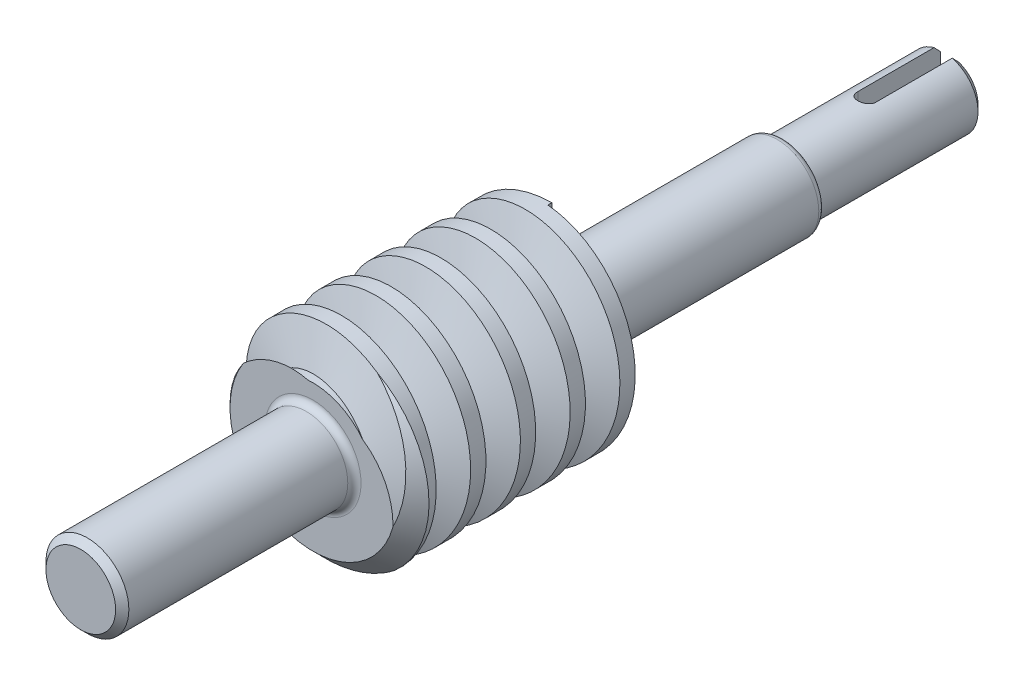
from build123d import *

# Parameters (mm, degrees)
SKETCH1_R                = 30
BOSS_EXTRUDE1_DEPTH      = 36
CHAMFER1_SIZE            = 5
CUT_SWEEP1_PITCH         = 15
BOSS_EXTRUDE2_DEPTH      = 70
BOSS_EXTRUDE2_DEPTH_BACK = 142
SKETCH4_R                = 12.5
SKETCH5_R                = 10.5
BOSS_EXTRUDE3_DEPTH      = 50
FILLET1_R                = 2
CHAMFER2_SIZE            = 2
CUT_EXTRUDE1_DEPTH       = 50


with BuildPart() as part:
    # Sketch1 → Boss-Extrude1 (new, symmetric)
    with BuildSketch(Plane.XY):
        Circle(SKETCH1_R)
    extrude(amount=BOSS_EXTRUDE1_DEPTH, both=True)

    # Chamfer1
    chamfer1_edges = [part.edges().sort_by_distance(p)[0] for p in [
        (-30, 0, 36),
    ]]
    chamfer(chamfer1_edges, length=CHAMFER1_SIZE)

    # Cut-Sweep1: the profile of Sketch2 screwed along a left-hand helix of 6 turns, 18 arcs to a turn; built about Z, then put on its axis
    cut_sweep1_z = Axis((0, 0, 0), (0, 0, 1))
    cut_sweep1_corners = [(34, 0, -7.84), (34, 0, 5.459553514), (19, 0, 0), (19, 0, -2.380446486)]
    with BuildLine(mode=Mode.PRIVATE) as cut_sweep1_profile:
        Line(cut_sweep1_corners[0], cut_sweep1_corners[1])
        Line(cut_sweep1_corners[1], cut_sweep1_corners[2])
        Line(cut_sweep1_corners[2], cut_sweep1_corners[3])
        Line(cut_sweep1_corners[3], cut_sweep1_corners[0])
    cut_sweep1_cap = Face(cut_sweep1_profile.wire())
    cut_sweep1_turn_angles = [0, -10, -20, -30, -40, -50, -60, -70, -80, -90, -100, -110, -120, -130, -140, -150, -160, -170, -180, -190, -200, -210, -220, -230, -240, -250, -260, -270, -280, -290, -300, -310, -320, -330, -340, -350, -360]
    cut_sweep1_turn_weights = [1, 0.984807753012208, 1, 0.984807753012208, 1, 0.984807753012208, 1, 0.984807753012208, 1, 0.984807753012208, 1, 0.984807753012208, 1, 0.984807753012208, 1, 0.984807753012208, 1, 0.984807753012208, 1, 0.984807753012208, 1, 0.984807753012208, 1, 0.984807753012208, 1, 0.984807753012208, 1, 0.984807753012208, 1, 0.984807753012208, 1, 0.984807753012208, 1, 0.984807753012208, 1, 0.984807753012208, 1]
    cut_sweep1_turn_rails = [Edge.make_bspline([Vector(p[0], p[1], 0).rotate(cut_sweep1_z, cut_sweep1_turn_angles[k]) / cut_sweep1_turn_weights[k] + Vector(0, 0, p[2] + -CUT_SWEEP1_PITCH * cut_sweep1_turn_angles[k] / 360) for k in range(37)], [0, 0, 0, 1, 1, 2, 2, 3, 3, 4, 4, 5, 5, 6, 6, 7, 7, 8, 8, 9, 9, 10, 10, 11, 11, 12, 12, 13, 13, 14, 14, 15, 15, 16, 16, 17, 17, 18, 18, 18], 2, cut_sweep1_turn_weights) for p in cut_sweep1_corners]
    cut_sweep1_turn_sides = [Face.make_surface_from_curves(cut_sweep1_turn_rails[p[0]], cut_sweep1_turn_rails[p[1]]) for p in [(0, 1), (1, 2), (2, 3), (3, 0)]]
    cut_sweep1 = Plane(origin=(0, 0, 48.809776757), x_dir=(0, 1, 0), z_dir=(0, 0, -1)) * Solid(Shell([*[p.moved(Location((0, 0, CUT_SWEEP1_PITCH * i))) for i in range(6) for p in cut_sweep1_turn_sides], cut_sweep1_cap, cut_sweep1_cap.rotate(cut_sweep1_z, -2160).moved(Location((0, 0, -CUT_SWEEP1_PITCH * -2160 / 360)))]))
    add(cut_sweep1, mode=Mode.SUBTRACT)

    # Sketch4 → Boss-Extrude2 (add, two sides: drawn at the far end of the back side and taken through both)
    with BuildSketch(Plane.XY.offset(36).offset(-BOSS_EXTRUDE2_DEPTH_BACK)):
        Circle(SKETCH4_R)
    extrude(amount=BOSS_EXTRUDE2_DEPTH + BOSS_EXTRUDE2_DEPTH_BACK)

    # Sketch5 → Boss-Extrude3 (add)
    with BuildSketch(Plane(origin=(0, 0, -106), x_dir=(-1, 0, 0), z_dir=(0, 0, -1))):
        Circle(SKETCH5_R)
    extrude(amount=BOSS_EXTRUDE3_DEPTH)

    # Fillet1
    fillet1_edges = [part.edges().sort_by_distance(p)[0] for p in [
        (-12.5, 0, 36),
        (-12.5, 0, -36),
        (-12.5, 0, -106),
    ]]
    fillet(fillet1_edges, radius=FILLET1_R - 0.0001)  # a hair under: the kernel refuses the full size

    # Chamfer2
    chamfer2_edges = [part.edges().sort_by_distance(p)[0] for p in [
        (-12.5, 0, 106),
        (10.5, 0, -156),
    ]]
    chamfer(chamfer2_edges, length=CHAMFER2_SIZE)

    # Sketch6 → Cut-Extrude1 (cut)
    with BuildSketch(Plane(origin=(0, 0, 0), x_dir=(1, 0, 0), z_dir=(0, 1, 0))):
        with BuildLine():
            Line((2.75, 159.768031027), (2.75, 131))
            ThreePointArc((2.75, 131), (0, 128.25), (-2.75, 131))
            Line((-2.75, 131), (-2.75, 159.768031027))
            ThreePointArc((-2.75, 159.768031027), (0, 162.518031027), (2.75, 159.768031027))
        make_face()
    extrude(amount=CUT_EXTRUDE1_DEPTH, mode=Mode.SUBTRACT)


solid = part.part
